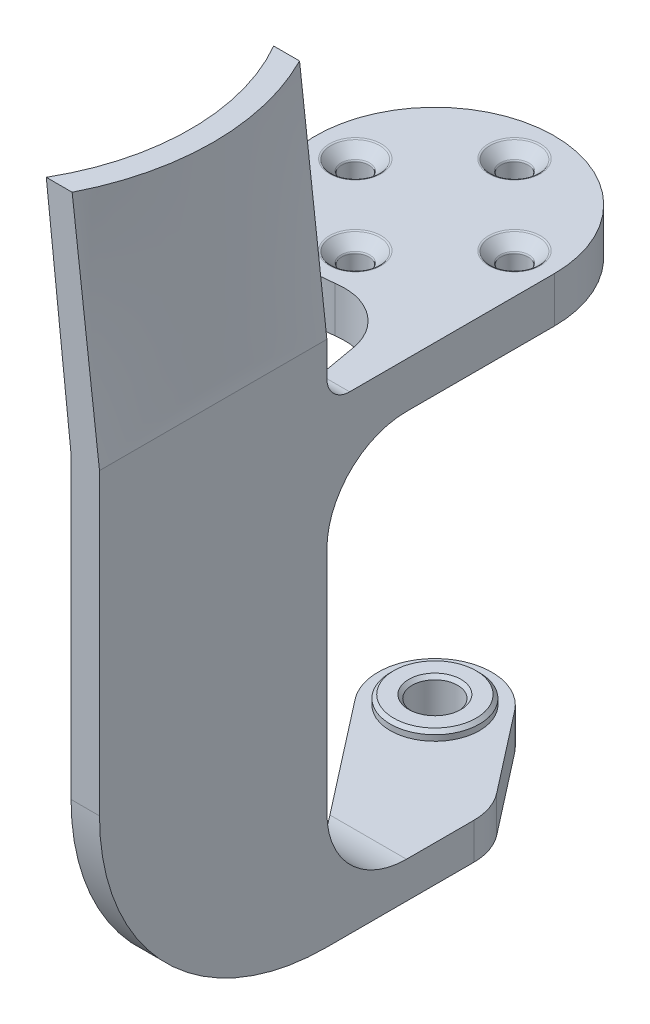
from build123d import *

# Parameters (mm, degrees)
BOSS_EXTRUDE1_DEPTH                                 = 4
CSK_FOR_M2_COUNTERSUNK_FLAT_HEAD_SCREW1_D           = 2.4
CSK_FOR_M2_COUNTERSUNK_FLAT_HEAD_SCREW1_DEPTH       = 4
CSK_FOR_M2_COUNTERSUNK_FLAT_HEAD_SCREW1_CSINK_D     = 4.4
CSK_FOR_M2_COUNTERSUNK_FLAT_HEAD_SCREW1_CSINK_ANGLE = 90
CSK_FOR_M2_COUNTERSUNK_FLAT_HEAD_SCREW1_TIP         = 0.721032743
CUT_EXTRUDE1_DEPTH                                  = 1
BOSS_EXTRUDE2_START                                 = 0.2
SKETCH6_R                                           = 3.92
BOSS_EXTRUDE2_DEPTH                                 = 0.8
BOSS_EXTRUDE3_DEPTH                                 = 3.2
SKETCH10_R                                          = 2
CUT_EXTRUDE2_DEPTH                                  = 5
SKETCH11_R                                          = 3.75
CUT_EXTRUDE3_DEPTH                                  = 0.4
SKETCH12_W                                          = 2.5
SKETCH12_H                                          = 20
BOSS_EXTRUDE4_DEPTH                                 = 43.1
FILLET1_R                                           = 7
FILLET2_R                                           = 20
CHAMFER1_SIZE                                       = 0.3
FILLET3_R                                           = 0.2
CHAMFER2_SIZE                                       = 0.5
FILLET4_R                                           = 0.2
FILLET6_R                                           = 5
FILLET7_R                                           = 2


with BuildPart() as part:
    # Sketch2 → Boss-Extrude1 (new body)
    with BuildSketch(Plane(origin=(0, 33.6, 0), x_dir=(1, 0, 0), z_dir=(0, 1, 0))):
        with BuildLine():
            Line((10.5, 9.7), (10.5, -8.747082129))
            Line((10.5, -8.747082129), (10.5, -30.3))
            Line((10.5, -30.3), (8, -30.3))
            Line((8, -30.3), (8, -8.747082129))
            Line((8, -8.747082129), (6.236730193, 1.252917871))
            ThreePointArc((6.236730193, 1.252917871), (-9.373784375, 14.430979443), (10.5, 9.7))
        make_face()
    extrude(amount=BOSS_EXTRUDE1_DEPTH)

    # CSK for M2 Countersunk Flat Head Screw1
    with Locations(Plane(origin=(0, 37.6, 0), x_dir=(1, 0, 0), z_dir=(0, 1, 0))):
        with Locations((0, 2.7), (7, 9.7), (0, 16.7), (-7, 9.7)):
            CounterSinkHole(CSK_FOR_M2_COUNTERSUNK_FLAT_HEAD_SCREW1_D / 2, CSK_FOR_M2_COUNTERSUNK_FLAT_HEAD_SCREW1_CSINK_D / 2, depth=CSK_FOR_M2_COUNTERSUNK_FLAT_HEAD_SCREW1_DEPTH, counter_sink_angle=CSK_FOR_M2_COUNTERSUNK_FLAT_HEAD_SCREW1_CSINK_ANGLE)
            with Locations((0, 0, -(CSK_FOR_M2_COUNTERSUNK_FLAT_HEAD_SCREW1_DEPTH + CSK_FOR_M2_COUNTERSUNK_FLAT_HEAD_SCREW1_TIP / 2))):  # 118° drill point
                Cone(0, CSK_FOR_M2_COUNTERSUNK_FLAT_HEAD_SCREW1_D / 2, CSK_FOR_M2_COUNTERSUNK_FLAT_HEAD_SCREW1_TIP, mode=Mode.SUBTRACT)

    # Sketch5 → Cut-Extrude1 (cut)
    with BuildSketch(Plane.XZ.offset(-33.6)):
        with BuildLine():
            Line((-4.82, -20.2), (-4.82, -9.7))
            ThreePointArc((-4.82, -9.7), (0, -4.88), (4.82, -9.7))
            Line((4.82, -9.7), (4.82, -20.2))
            ThreePointArc((4.82, -20.2), (0, -25.02), (-4.82, -20.2))
        make_face()
    extrude(amount=-CUT_EXTRUDE1_DEPTH, mode=Mode.SUBTRACT)



with BuildPart() as body_2:
    # Sketch6 → Boss-Extrude2 (new body)
    with BuildSketch(Plane.XZ.offset(-0.5).offset(BOSS_EXTRUDE2_START)):
        with Locations(Location((0, -9.7, 0), (0, 0, 270))):
            Circle(SKETCH6_R)
    extrude(amount=BOSS_EXTRUDE2_DEPTH)

    # Sketch7 → Boss-Extrude3 (add)
    with BuildSketch(Plane.XZ.offset(0.5)):
        with BuildLine():
            Line((-3.948430619, -6.632444679), (8, 8.747082129))
            Line((8, 8.747082129), (8, 30.3))
            Line((8, 30.3), (10.5, 30.3))
            Line((10.5, 30.3), (10.5, -4.334645582))
            Line((10.5, -4.334645582), (3.948430619, -12.767555321))
            ThreePointArc((3.948430619, -12.767555321), (-3.067555321, -13.648430619), (-3.948430619, -6.632444679))
        make_face()
    extrude(amount=BOSS_EXTRUDE3_DEPTH)

    # Sketch10 → Cut-Extrude2 (cut)
    with BuildSketch(Plane.XZ.offset(3.7)):
        with Locations(Location((0, -9.7, 0), (0, 0, 270))):
            Circle(SKETCH10_R)
    extrude(amount=-CUT_EXTRUDE2_DEPTH, mode=Mode.SUBTRACT)

    # Sketch11 → Cut-Extrude3 (cut)
    with BuildSketch(Plane.XZ.offset(3.7)):
        with Locations(Location((0, -9.7, 0), (0, 0, 270))):
            Circle(SKETCH11_R)
    extrude(amount=-CUT_EXTRUDE3_DEPTH, mode=Mode.SUBTRACT)


with BuildPart() as part_1:
    add(part.part)

    add(body_2.part)  # Boss-Extrude4 merges body 2
    # Sketch12 → Boss-Extrude4 (add)
    with BuildSketch(Plane(origin=(0, -0.5, 0), x_dir=(1, 0, 0), z_dir=(0, 1, 0))):
        with Locations((9.25, -20.3)):
            Rectangle(SKETCH12_W, SKETCH12_H)
    extrude(amount=BOSS_EXTRUDE4_DEPTH)

    # Fillet1
    fillet1_edges = [part_1.edges().sort_by_distance(p)[0] for p in [
        (9.25, -0.5, 10.3),
        (9.25, 33.6, 10.3),
    ]]
    fillet(fillet1_edges, radius=FILLET1_R)

    # Fillet2
    fillet2_edges = [part_1.edges().sort_by_distance(p)[0] for p in [
        (9.25, -3.7, 30.3),
    ]]
    fillet(fillet2_edges, radius=FILLET2_R)

    # Chamfer1
    chamfer1_edges = [part_1.edges().sort_by_distance(p)[0] for p in [
        (0, 0.3, -5.78),
        (0, 0.3, -7.7),
    ]]
    chamfer(chamfer1_edges, length=CHAMFER1_SIZE)

    # Fillet3
    fillet3_edges = [part_1.edges().sort_by_distance(p)[0] for p in [
        (0, -3.3, -5.95),
        (0, -3.3, -7.7),
    ]]
    fillet(fillet3_edges, radius=FILLET3_R)

    # Chamfer2
    # the kernel refuses this chamfer: 0.5, 0.371068727 mm, written as the material it takes off along each edge
    with BuildSketch(Plane(origin=(-4.82, 34.6, -19.028322464), x_dir=(-0.8802070458412009, 0, 0.47458988237372485), z_dir=(0, -1, 0))) as chamfer2_piece_1:
        with BuildLine():
            Line((0.369059, 0), (CHAMFER2_SIZE * 0.474589882374, -CHAMFER2_SIZE * 0.880207045841))
            Line((CHAMFER2_SIZE * 0.474589882374, -CHAMFER2_SIZE * 0.880207045841), (0, 0))
            ThreePointArc((0, 0), (0.187395474, 0.001621217), (0.369059, 0))
        make_face()
    extrude(amount=2.285841494, mode=Mode.SUBTRACT)
    with BuildSketch(Plane(origin=(4.82, 34.6, -19.028322464), x_dir=(0.8802070458411981, 0, 0.47458988237373034), z_dir=(0, -1, 0))) as chamfer2_piece_2:
        with BuildLine():
            Line((0.369059, 0), (CHAMFER2_SIZE * 0.474589882374, CHAMFER2_SIZE * 0.880207045841))
            Line((CHAMFER2_SIZE * 0.474589882374, CHAMFER2_SIZE * 0.880207045841), (0, 0))
            ThreePointArc((0, 0), (0.187395474, -0.001621217), (0.369059, 0))
        make_face()
    extrude(amount=2.285841494, mode=Mode.SUBTRACT)
    with BuildSketch(Plane(origin=(0, 34.6, -9.7), x_dir=(-0.5641489275295863, 0, -0.825673051254077), z_dir=(-0.825673051254077, 0, 0.5641489275295863))) as chamfer2_piece_3_section:
        Polygon((10.5, -CHAMFER2_SIZE), (10.5 - CHAMFER2_SIZE, 0), (10.5, 0), align=None)
    chamfer2_piece_3 = revolve(axis=Axis((0, 34.6, -9.7), (0, -1, 0)), revolution_arc=68.686424342, mode=Mode.PRIVATE)
    chamfer2_piece_3 = split(chamfer2_piece_3, bisect_by=Plane(origin=(-4.82, 34.6, -9.7), z_dir=(1, 0, 0)), keep=Keep.TOP, mode=Mode.PRIVATE)
    chamfer2_piece_3 = split(chamfer2_piece_3, bisect_by=Plane(origin=(4.82, 34.6, -9.7), z_dir=(-1, 0, 0)), keep=Keep.TOP, mode=Mode.PRIVATE)
    add(chamfer2_piece_3, mode=Mode.SUBTRACT)
    with BuildSketch(Plane(origin=(-4.82, 35.885841494, -19.028322464), x_dir=(-0.8802070458412009, 0, 0.47458988237372485), z_dir=(0, -1, 0))) as chamfer2_piece_4a_section:
        with BuildLine():
            Line((0.369059, 0), (CHAMFER2_SIZE * 0.474589882374, -CHAMFER2_SIZE * 0.880207045841))
            Line((CHAMFER2_SIZE * 0.474589882374, -CHAMFER2_SIZE * 0.880207045841), (0, 0))
            ThreePointArc((0, 0), (0.187395474, 0.001621217), (0.369059, 0))
        make_face()
    chamfer2_piece_4a = extrude(amount=3.571682988, mode=Mode.PRIVATE)
    chamfer2_piece_4a = split(chamfer2_piece_4a, bisect_by=Plane(origin=(-4.82, 34.6, -19.028322464), z_dir=(0, 1, 0)), keep=Keep.TOP, mode=Mode.PRIVATE)
    with BuildSketch(Plane(origin=(0, 34.6, -9.7), x_dir=(-0.5641489275295863, 0, -0.825673051254077), z_dir=(-0.825673051254077, 0, 0.5641489275295863))) as chamfer2_piece_4b_section:
        Polygon((10.5, -CHAMFER2_SIZE), (10.5 - CHAMFER2_SIZE, 0), (10.5, 0), align=None)
    chamfer2_piece_4b = revolve(axis=Axis((0, 34.6, -9.7), (0, -1, 0)), revolution_arc=68.686424342, mode=Mode.PRIVATE)
    chamfer2_piece_4b = split(chamfer2_piece_4b, bisect_by=Plane(origin=(-4.82, 34.6, -9.7), z_dir=(-1, 0, 0)), keep=Keep.TOP, mode=Mode.PRIVATE)
    chamfer2_piece_4 = chamfer2_piece_4a & chamfer2_piece_4b
    add(chamfer2_piece_4, mode=Mode.SUBTRACT)
    with BuildSketch(Plane(origin=(0, 34.6, -9.7), x_dir=(-0.5641489275295863, 0, -0.825673051254077), z_dir=(-0.825673051254077, 0, 0.5641489275295863))) as chamfer2_piece_5a_section:
        Polygon((10.5, -CHAMFER2_SIZE), (10.5 - CHAMFER2_SIZE, 0), (10.5, 0), align=None)
    chamfer2_piece_5a = revolve(axis=Axis((0, 34.6, -9.7), (0, -1, 0)), revolution_arc=68.686424342, mode=Mode.PRIVATE)
    chamfer2_piece_5a = split(chamfer2_piece_5a, bisect_by=Plane(origin=(4.82, 34.6, -9.7), z_dir=(1, 0, 0)), keep=Keep.TOP, mode=Mode.PRIVATE)
    with BuildSketch(Plane(origin=(4.82, 35.885841494, -19.028322464), x_dir=(0.8802070458411981, 0, 0.47458988237373034), z_dir=(0, -1, 0))) as chamfer2_piece_5b_section:
        with BuildLine():
            Line((0.369059, 0), (CHAMFER2_SIZE * 0.474589882374, CHAMFER2_SIZE * 0.880207045841))
            Line((CHAMFER2_SIZE * 0.474589882374, CHAMFER2_SIZE * 0.880207045841), (0, 0))
            ThreePointArc((0, 0), (0.187395474, -0.001621217), (0.369059, 0))
        make_face()
    chamfer2_piece_5b = extrude(amount=3.571682988, mode=Mode.PRIVATE)
    chamfer2_piece_5b = split(chamfer2_piece_5b, bisect_by=Plane(origin=(4.82, 34.6, -19.028322464), z_dir=(0, 1, 0)), keep=Keep.TOP, mode=Mode.PRIVATE)
    chamfer2_piece_5 = chamfer2_piece_5a & chamfer2_piece_5b
    add(chamfer2_piece_5, mode=Mode.SUBTRACT)

    # Fillet4
    fillet4_edges = [part_1.edges().sort_by_distance(p)[0] for p in [
        (-4.8, 37.6, -9.7),
        (-5.8, 33.6, -9.7),
        (-5.8, 36.6, -9.7),
        (2.2, 37.6, -16.7),
        (1.2, 36.6, -16.7),
        (9.2, 37.6, -9.7),
        (8.2, 33.6, -9.7),
        (8.2, 36.6, -9.7),
        (2.2, 37.6, -2.7),
        (1.2, 33.6, -2.7),
        (1.2, 36.6, -2.7),
        (1.2, 34.6, -16.7),
    ]]
    fillet(fillet4_edges, radius=FILLET4_R)

    # Fillet6
    fillet6_edges = [part_1.edges().sort_by_distance(p)[0] for p in [
        (8, 34.298254778, 8.747082129),
        (6.236730193, 35.6, -1.252917871),
        (10.5, -2.1, -4.334645582),
    ]]
    fillet(fillet6_edges, radius=FILLET6_R)

    # Fillet7
    fillet7_edges = [part_1.edges().sort_by_distance(p)[0] for p in [
        (9.25, 37.6, 10.3),
    ]]
    fillet(fillet7_edges, radius=FILLET7_R)

    # Loft1: read off the stored shape, not the designer's step
    # Loft1: loft between two sections, ruled curve by curve
    loft1_from = [
        Edge.make_bspline([(10.5, 42.6, 30.3), (10.5, 42.6, 28.633333333), (10.5, 42.6, 26.966666667), (10.5, 42.6, 23.633333333), (10.5, 42.6, 21.966666667), (10.5, 42.6, 18.633333333), (10.5, 42.6, 16.966666667), (10.5, 42.6, 13.633333333), (10.5, 42.6, 11.966666667), (10.5, 42.6, 10.3)], [0, 0, 0, 0, 0.25, 0.25, 0.5, 0.5, 0.75, 0.75, 1, 1, 1, 1], 3),
        Edge.make_bspline([(8, 42.6, 10.3), (8, 42.6, 11.966666667), (8, 42.6, 13.633333333), (8, 42.6, 16.966666667), (8, 42.6, 18.633333333), (8, 42.6, 21.966666667), (8, 42.6, 23.633333333), (8, 42.6, 26.966666667), (8, 42.6, 28.633333333), (8, 42.6, 30.3)], [0, 0, 0, 0, 0.25, 0.25, 0.5, 0.5, 0.75, 0.75, 1, 1, 1, 1], 3),
        Edge.make_line((8, 42.6, 10.3), (10.5, 42.6, 10.3)),
        Edge.make_line((8, 42.6, 30.3), (10.5, 42.6, 30.3)),
    ]
    loft1_to = [
        Edge.make_bspline([(8.095917942, 62.6, 30.3), (8.8534937, 62.6, 28.815460762), (9.461447627, 62.6, 27.202025065), (10.28514852, 62.6, 23.825271703), (10.5, 62.6, 22.062993509), (10.5, 62.6, 18.537006491), (10.28514852, 62.6, 16.774728297), (9.461447627, 62.6, 13.397974935), (8.8534937, 62.6, 11.784539238), (8.095917942, 62.6, 10.3)], [0, 0, 0, 0, 0.25, 0.25, 0.5, 0.5, 0.75, 0.75, 1, 1, 1, 1], 3),
        Edge.make_bspline([(5.820508076, 62.6, 10.3), (6.653841409, 62.6, 11.743375673), (7.332777675, 62.6, 13.342564126), (8.256606348, 62.6, 16.728454883), (8.5, 62.6, 18.51367205), (8.5, 62.6, 22.08632795), (8.256606348, 62.6, 23.871545117), (7.332777675, 62.6, 27.257435874), (6.653841409, 62.6, 28.856624327), (5.820508076, 62.6, 30.3)], [0, 0, 0, 0, 0.25, 0.25, 0.5, 0.5, 0.75, 0.75, 1, 1, 1, 1], 3),
        Edge.make_line((5.820508076, 62.6, 10.3), (8.095917942, 62.6, 10.3)),
        Edge.make_line((5.820508076, 62.6, 30.3), (8.095917942, 62.6, 30.3)),
    ]
    loft1 = Solid(Shell([*[Face.make_surface_from_curves(loft1_from[k], loft1_to[k]) for k in range(4)], Face(Wire(loft1_from)), Face(Wire(loft1_to))]))
    add(loft1)


solid = part_1.part
